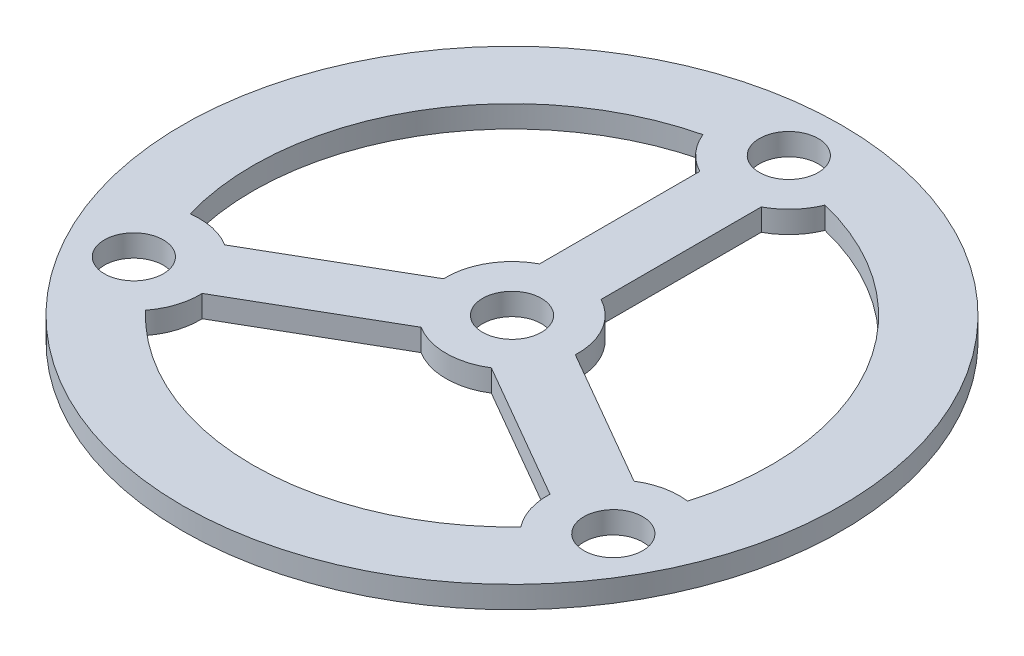
from build123d import *
from build123d.topology import SkipClean

# Parameters (mm, degrees)
SKETCH1_R           = 37.5
SKETCH1_R_2         = 3.35
BOSS_EXTRUDE1_DEPTH = 2.5
BOSS_EXTRUDE2_DEPTH = 2.5


with BuildPart() as part:
    # Sketch1 → Boss-Extrude1 (new body)
    with BuildSketch(Plane(origin=(0, 0, 0), x_dir=(1, 0, 0), z_dir=(0, 1, 0))):
        Circle(SKETCH1_R)
        with Locations((0, 31.5)):
            Circle(SKETCH1_R_2, mode=Mode.SUBTRACT)
        with Locations((27.279800219, -15.75)):
            Circle(SKETCH1_R_2, mode=Mode.SUBTRACT)
        with Locations((-27.279800219, -15.75)):
            Circle(SKETCH1_R_2, mode=Mode.SUBTRACT)
        with BuildLine():
            ThreePointArc((-6.945839996, 28.670634921), (-25.547749412, 14.75), (-28.302418182, -8.320043573))
            ThreePointArc((-28.302418182, -8.320043573), (-20.784609691, -12), (-21.356578186, -20.350591347))
            ThreePointArc((-21.356578186, -20.350591347), (0, -29.5), (21.356578186, -20.350591347))
            ThreePointArc((21.356578186, -20.350591347), (20.784609691, -12), (28.302418182, -8.320043573))
            ThreePointArc((28.302418182, -8.320043573), (25.547749412, 14.75), (6.945839996, 28.670634921))
            ThreePointArc((6.945839996, 28.670634921), (0, 24), (-6.945839996, 28.670634921))
        make_face(mode=Mode.SUBTRACT)
    extrude(amount=BOSS_EXTRUDE1_DEPTH)

    # Sketch2 → Boss-Extrude2 (add)
    with SkipClean():  # the faces are left unmerged after this step: merging them gives an invalid solid
        with BuildSketch(Plane(origin=(0, 0, 0), x_dir=(1, 0, 0), z_dir=(0, 1, 0))):
            with BuildLine():
                Line((-3.5, 31.5), (-3.5, 6.633249581))
                ThreePointArc((-3.5, 6.633249581), (-6.495190528, 3.75), (-7.494562647, -0.285535877))
                Line((-7.494562647, -0.285535877), (-29.029800219, -12.718911087))
                Line((-29.029800219, -12.718911087), (-28.954800219, -12.848814897))
                ThreePointArc((-28.954800219, -12.848814897), (-24.378615117, -14.075), (-25.604800219, -18.651185103))
                Line((-25.604800219, -18.651185103), (-25.529800219, -18.781088913))
                Line((-25.529800219, -18.781088913), (-3.994562647, -6.347713704))
                ThreePointArc((-3.994562647, -6.347713704), (0, -7.5), (3.994562647, -6.347713704))
                Line((3.994562647, -6.347713704), (25.529800219, -18.781088913))
                Line((25.529800219, -18.781088913), (25.604800219, -18.651185103))
                ThreePointArc((25.604800219, -18.651185103), (24.378615117, -14.075), (28.954800219, -12.848814897))
                Line((28.954800219, -12.848814897), (29.029800219, -12.718911087))
                Line((29.029800219, -12.718911087), (7.494562647, -0.285535877))
                ThreePointArc((7.494562647, -0.285535877), (6.495190528, 3.75), (3.5, 6.633249581))
                Line((3.5, 6.633249581), (3.5, 31.5))
                Line((3.5, 31.5), (3.35, 31.5))
                ThreePointArc((3.35, 31.5), (0, 28.15), (-3.35, 31.5))
                Line((-3.35, 31.5), (-3.5, 31.5))
            make_face()
            with BuildLine():
                ThreePointArc((-1.675, 2.901185103), (2.901185103, 1.675), (1.675, -2.901185103))
                ThreePointArc((1.675, -2.901185103), (-2.901185103, -1.675), (-1.675, 2.901185103))
            make_face(mode=Mode.SUBTRACT)
        extrude(amount=BOSS_EXTRUDE2_DEPTH)


solid = part.part
